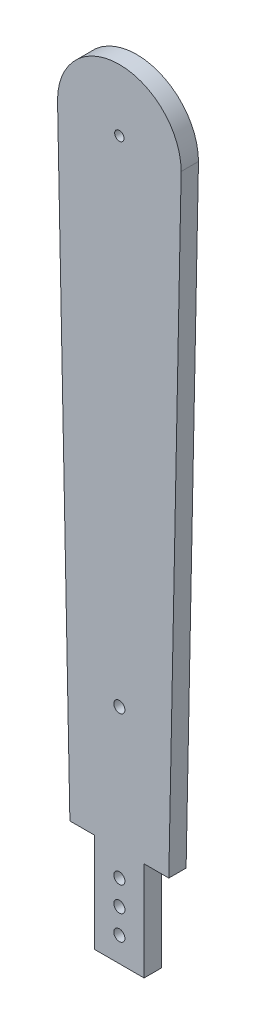
from build123d import *

# Parameters (mm, degrees)
BOSS_EXTRUDE3_DEPTH = 3.5
SKETCH18_R          = 2.25
CUT_EXTRUDE10_DEPTH = 14
SKETCH17_R          = 1.9
CUT_EXTRUDE13_DEPTH = 24
SKETCH14_W          = 20
SKETCH14_H          = 7
BOSS_EXTRUDE4_DEPTH = 40
SKETCH23_R          = 2.25
CUT_EXTRUDE15_DEPTH = 7


with BuildPart() as part:
    # Sketch7 → Boss-Extrude3 (new, symmetric)
    with BuildSketch(Plane.XY):
        with BuildLine():
            ThreePointArc((25, 0), (0, 25), (-25, 0))
            Line((-25, 0), (-20, -250))
            Line((-20, -250), (20, -250))
            Line((20, -250), (25, 0))
        make_face()
    extrude(amount=BOSS_EXTRUDE3_DEPTH, both=True)

    # Sketch18 → Cut-Extrude10 (cut)
    with BuildSketch(Plane.XY.offset(3.5)):
        with Locations((0, -200)):
            Circle(SKETCH18_R)
    extrude(amount=-CUT_EXTRUDE10_DEPTH, mode=Mode.SUBTRACT)

    # Sketch17 → Cut-Extrude13 (cut, symmetric)
    with BuildSketch(Plane.XY.offset(3.5)):
        Circle(SKETCH17_R)
    extrude(amount=CUT_EXTRUDE13_DEPTH, both=True, mode=Mode.SUBTRACT)

    # Sketch14 → Boss-Extrude4 (add)
    with BuildSketch(Plane.XZ.offset(250)):
        Rectangle(SKETCH14_W, SKETCH14_H)
    extrude(amount=BOSS_EXTRUDE4_DEPTH)

    # Sketch23 → Cut-Extrude15 (cut)
    with BuildSketch(Plane.XY.offset(3.5)):
        with Locations((0, -260)):
            Circle(SKETCH23_R)
        with Locations((0, -280)):
            Circle(SKETCH23_R)
        with Locations((0, -270)):
            Circle(SKETCH23_R)
    extrude(amount=-CUT_EXTRUDE15_DEPTH, mode=Mode.SUBTRACT)


solid = part.part
